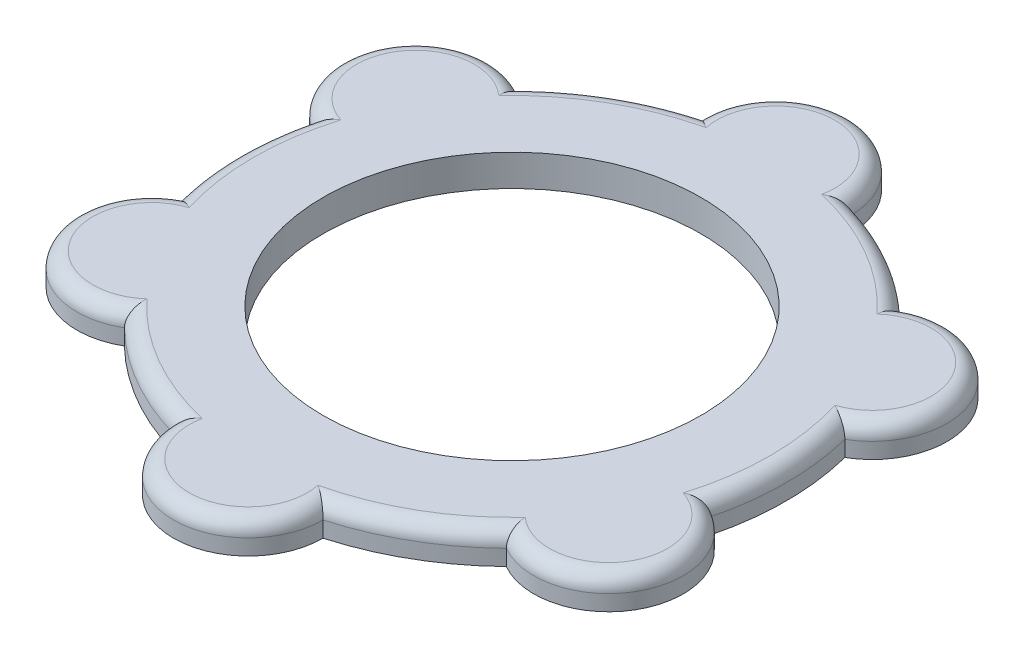
from build123d import *

# Parameters (mm, degrees)
SKETCH1_R           = 30.48
BOSS_EXTRUDE1_DEPTH = 5.08
FILLET1_R           = 2.54
SHELL1_OUTLINE_R    = 33.02
SHELL1_DEPTH        = 2.54
SKETCH2_R           = 3.81
SKETCH2_R_2         = 3.175
BOSS_EXTRUDE2_DEPTH = 2.54
CIRPATTERN1_COUNT   = 6


# Read off the part's stored shape, not the designer's step: Shell1
with BuildPart() as part:
    # Sketch1 → Boss-Extrude1 (new body)
    with BuildSketch(Plane(origin=(0, 0, 0), x_dir=(1, 0, 0), z_dir=(0, 1, 0))):
        with BuildLine():
            ThreePointArc((12.065, 42.545), (0, 54.61), (-12.065, 42.545))
            ThreePointArc((-12.065, 42.545), (-22.11131639, 38.29792341), (-30.812550804, 31.721096497))
            ThreePointArc((-30.812550804, 31.721096497), (-47.293647301, 27.305), (-42.877550804, 10.823903503))
            ThreePointArc((-42.877550804, 10.823903503), (-44.22263278, 0), (-42.877550804, -10.823903503))
            ThreePointArc((-42.877550804, -10.823903503), (-47.293647301, -27.305), (-30.812550804, -31.721096497))
            ThreePointArc((-30.812550804, -31.721096497), (-22.11131639, -38.29792341), (-12.065, -42.545))
            ThreePointArc((-12.065, -42.545), (0, -54.61), (12.065, -42.545))
            ThreePointArc((12.065, -42.545), (22.11131639, -38.29792341), (30.812550804, -31.721096497))
            ThreePointArc((30.812550804, -31.721096497), (47.293647301, -27.305), (42.877550804, -10.823903503))
            ThreePointArc((42.877550804, -10.823903503), (44.22263278, 0), (42.877550804, 10.823903503))
            ThreePointArc((42.877550804, 10.823903503), (47.293647301, 27.305), (30.812550804, 31.721096497))
            ThreePointArc((30.812550804, 31.721096497), (22.11131639, 38.29792341), (12.065, 42.545))
        make_face()
        with Locations(Location((0, 0, 0), (0, 0, 270))):
            Circle(SKETCH1_R, mode=Mode.SUBTRACT)
    extrude(amount=BOSS_EXTRUDE1_DEPTH)

    # Fillet1
    fillet1_edges = [part.edges().sort_by_distance(p)[0] for p in [
        (-44.22263278, 5.08, 0),
        (-47.293647301, 5.08, 27.305),
        (-22.11131639, 5.08, 38.29792341),
        (0, 5.08, 54.61),
        (22.11131639, 5.08, 38.29792341),
        (47.293647301, 5.08, 27.305),
        (44.22263278, 5.08, 0),
        (47.293647301, 5.08, -27.305),
        (22.11131639, 5.08, -38.29792341),
        (0, 5.08, -54.61),
        (-22.11131639, 5.08, -38.29792341),
        (-47.293647301, 5.08, -27.305),
    ]]
    fillet(fillet1_edges, radius=FILLET1_R)

    # Shell1 outline → Shell1 (cut)
    with BuildSketch(Plane(origin=(0, 0, 0), x_dir=(1, 0, 0), z_dir=(0, 1, 0))):
        with BuildLine():
            ThreePointArc((-9.329510581, 40.625141327), (-20.84131639, 36.098218884), (-30.517649131, 28.392163831))
            ThreePointArc((-30.517649131, 28.392163831), (-45.093942775, 26.035), (-39.847159711, 12.232977496))
            ThreePointArc((-39.847159711, 12.232977496), (-41.68263278, 0), (-39.847159711, -12.232977496))
            ThreePointArc((-39.847159711, -12.232977496), (-45.093942775, -26.035), (-30.517649131, -28.392163831))
            ThreePointArc((-30.517649131, -28.392163831), (-20.84131639, -36.098218884), (-9.329510581, -40.625141327))
            ThreePointArc((-9.329510581, -40.625141327), (0, -52.07), (9.329510581, -40.625141327))
            ThreePointArc((9.329510581, -40.625141327), (20.84131639, -36.098218884), (30.517649131, -28.392163831))
            ThreePointArc((30.517649131, -28.392163831), (45.093942775, -26.035), (39.847159711, -12.232977496))
            ThreePointArc((39.847159711, -12.232977496), (41.68263278, 0), (39.847159711, 12.232977496))
            ThreePointArc((39.847159711, 12.232977496), (45.093942775, 26.035), (30.517649131, 28.392163831))
            ThreePointArc((30.517649131, 28.392163831), (20.84131639, 36.098218884), (9.329510581, 40.625141327))
            ThreePointArc((9.329510581, 40.625141327), (0, 52.07), (-9.329510581, 40.625141327))
        make_face()
        Circle(SHELL1_OUTLINE_R, mode=Mode.SUBTRACT)
    extrude(amount=SHELL1_DEPTH, mode=Mode.SUBTRACT)

    # Sketch2 → Boss-Extrude2 (add)
    with BuildSketch(Plane.XZ.offset(-2.54)):
        with Locations(Location((0, 42.545, 0), (0, 0, 90))):
            Circle(SKETCH2_R)
        with Locations(Location((0, 42.545, 0), (0, 0, 90))):
            Circle(SKETCH2_R_2, mode=Mode.SUBTRACT)
    boss_extrude2 = extrude(amount=BOSS_EXTRUDE2_DEPTH)

    # CirPattern1: Boss-Extrude2 ×6 about axis
    cirpattern1_axis = Axis((0, 0, 0), (0, 1, 0))
    for i in range(1, CIRPATTERN1_COUNT):
        add(boss_extrude2.rotate(cirpattern1_axis, i * 360 / CIRPATTERN1_COUNT))


solid = part.part
